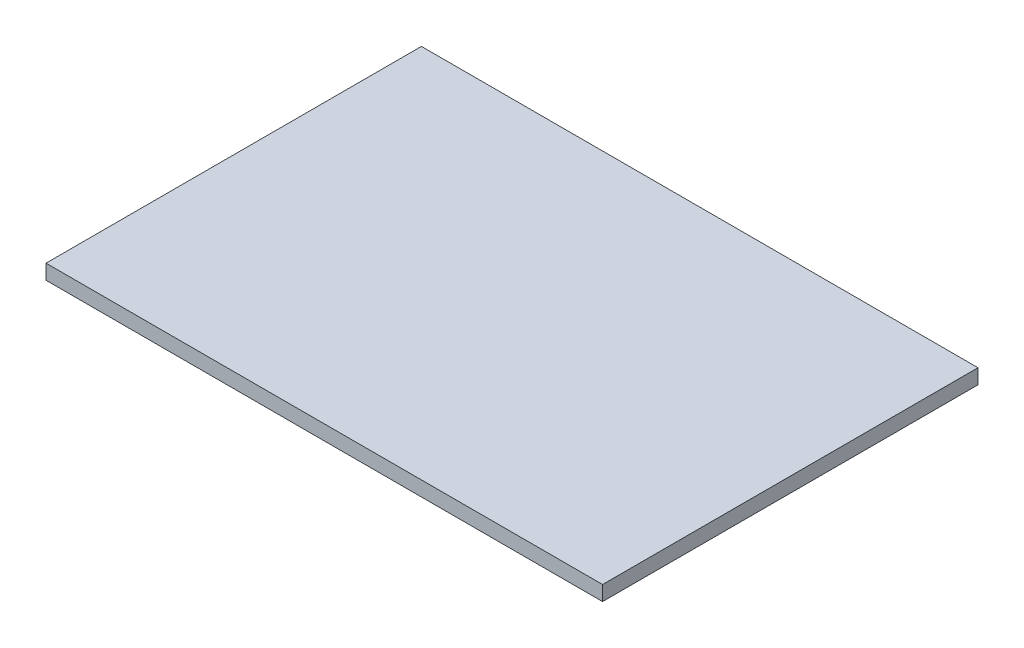
from build123d import *

# Parameters (mm, degrees)
SKETCH1_W           = 338
SKETCH1_H           = 228
BOSS_EXTRUDE1_DEPTH = 9


with BuildPart() as part:
    # Sketch1 → Boss-Extrude1 (new body)
    with BuildSketch(Plane(origin=(0, 0, 0), x_dir=(1, 0, 0), z_dir=(0, 1, 0))):
        Rectangle(SKETCH1_W, SKETCH1_H)
    extrude(amount=BOSS_EXTRUDE1_DEPTH)


solid = part.part
